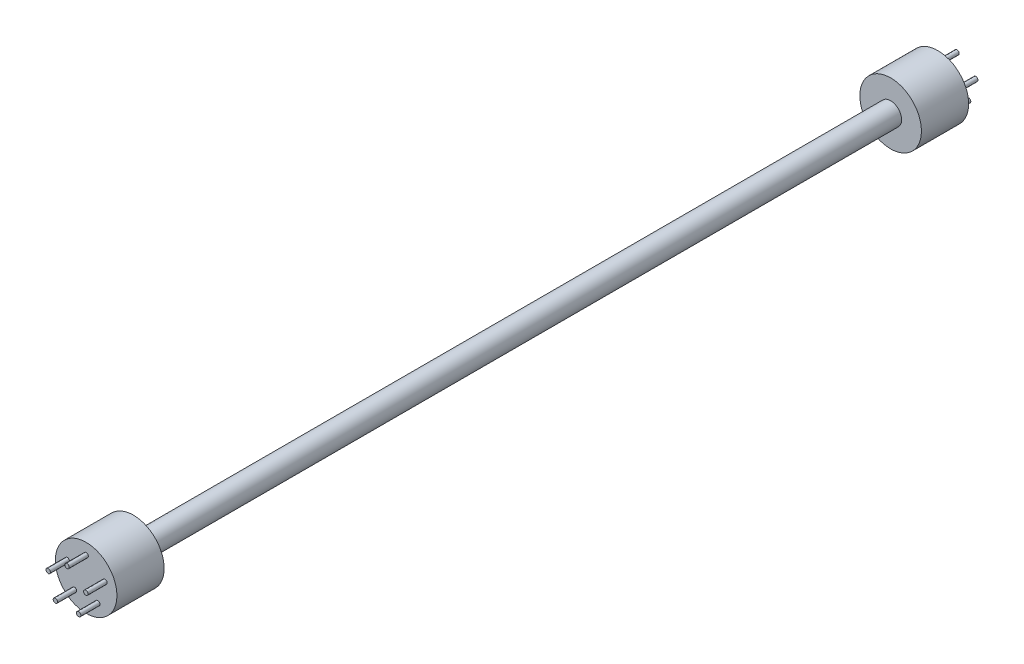
from build123d import *

# Parameters (mm, degrees)
SKETCH3_R           = 25
BOSS_EXTRUDE1_DEPTH = 1722.2
SKETCH4_R           = 70
BOSS_EXTRUDE2_DEPTH = 107.4
BOSS_EXTRUDE3_START = 107.4
SKETCH5_R           = 70
BOSS_EXTRUDE3_DEPTH = 107.4
SKETCH6_R           = 5
BOSS_EXTRUDE4_DEPTH = 43.5
BOSS_EXTRUDE5_START = 43.5
SKETCH7_R           = 5
BOSS_EXTRUDE5_DEPTH = 43.5


with BuildPart() as part:
    # Sketch3 → Boss-Extrude1 (new body)
    with BuildSketch(Plane.XY):
        Circle(SKETCH3_R)
    extrude(amount=-BOSS_EXTRUDE1_DEPTH)

    # Sketch4 → Boss-Extrude2 (add)
    with BuildSketch(Plane(origin=(0, 0, -1722.2), x_dir=(-1, 0, 0), z_dir=(0, 0, -1))):
        Circle(SKETCH4_R)
    extrude(amount=BOSS_EXTRUDE2_DEPTH)

    # Sketch5 → Boss-Extrude3 (add)
    with BuildSketch(Plane.XY.offset(BOSS_EXTRUDE3_START)):
        Circle(SKETCH5_R)
    extrude(amount=-BOSS_EXTRUDE3_DEPTH)

    # Sketch6 → Boss-Extrude4 (add)
    with BuildSketch(Plane.XY.offset(107.4)):
        with Locations((0, 45)):
            Circle(SKETCH6_R)
        with Locations((42.797543233, 13.905764747)):
            Circle(SKETCH6_R)
        with Locations((26.450336353, -36.405764747)):
            Circle(SKETCH6_R)
        with Locations((-26.450336353, -36.405764747)):
            Circle(SKETCH6_R)
        with Locations((-42.797543233, 13.905764747)):
            Circle(SKETCH6_R)
    extrude(amount=BOSS_EXTRUDE4_DEPTH)

    # Sketch7 → Boss-Extrude5 (add)
    with BuildSketch(Plane(origin=(0, 0, -1829.6), x_dir=(-1, 0, 0), z_dir=(0, 0, -1)).offset(BOSS_EXTRUDE5_START)):
        with Locations((0, 45)):
            Circle(SKETCH7_R)
        with Locations((42.797543233, 13.905764747)):
            Circle(SKETCH7_R)
        with Locations((26.450336353, -36.405764747)):
            Circle(SKETCH7_R)
        with Locations((-26.450336353, -36.405764747)):
            Circle(SKETCH7_R)
        with Locations((-42.797543233, 13.905764747)):
            Circle(SKETCH7_R)
    extrude(amount=-BOSS_EXTRUDE5_DEPTH)


solid = part.part
